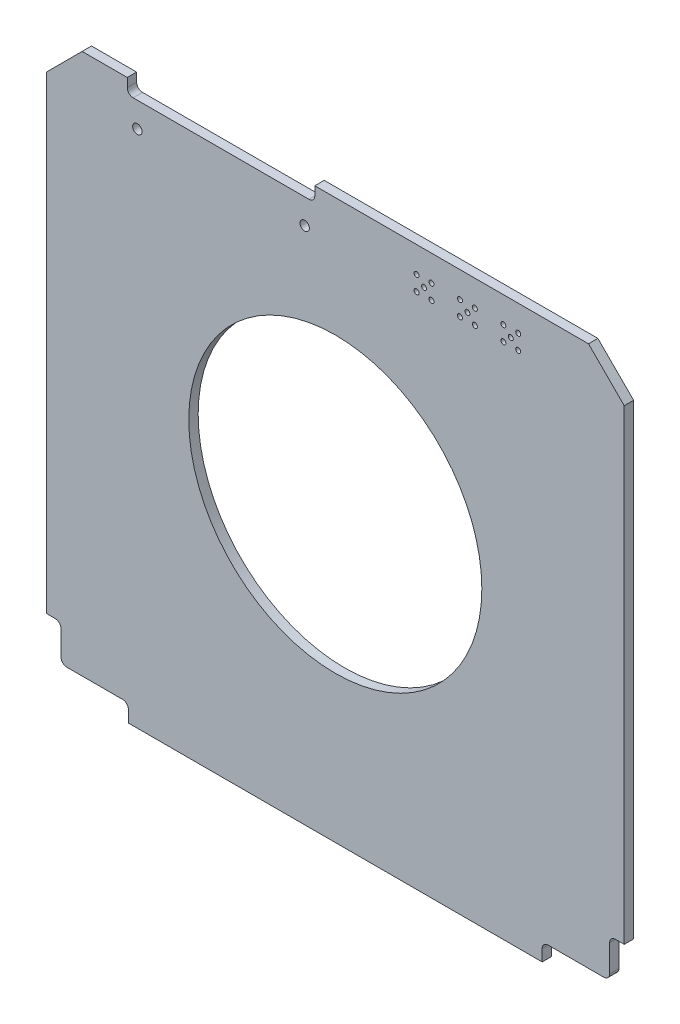
from build123d import *

# Parameters (mm, degrees)
SKETCH1_R           = 0.425
SKETCH1_R_2         = 25
SKETCH1_R_3         = 0.8
BOSS_EXTRUDE1_DEPTH = 1.6


with BuildPart() as part:
    # Sketch1 → Boss-Extrude1 (new body)
    with BuildSketch(Plane(origin=(0, 0, -0.0125), x_dir=(-1, 0, 0), z_dir=(0, 0, -1))):
        with BuildLine():
            Line((47.8, -40.8), (49.3, -40.8))
            Line((49.3, -40.8), (49.3, 39.2))
            Line((49.3, 39.2), (43.2, 45.3))
            Line((43.2, 45.3), (35.500000017, 45.3))
            Line((35.500000017, 45.3), (35.500000017, 43.8))
            ThreePointArc((35.500000017, 43.8), (35.207106799, 43.092893219), (34.500000017, 42.8))
            Line((34.500000017, 42.8), (4.500000014, 42.8))
            ThreePointArc((4.500000014, 42.8), (3.792893232, 43.092893219), (3.500000014, 43.8))
            Line((3.500000014, 43.8), (3.500000014, 45.3))
            Line((3.500000014, 45.3), (-43.2, 45.3))
            Line((-43.2, 45.3), (-49.3, 39.2))
            Line((-49.3, 39.2), (-49.3, -40.4))
            Line((-49.3, -40.4), (-47.8, -40.4))
            ThreePointArc((-47.8, -40.4), (-47.092893219, -40.692893219), (-46.8, -41.4))
            Line((-46.8, -41.4), (-46.8, -46))
            ThreePointArc((-46.8, -46), (-46.507106781, -46.707106781), (-45.8, -47))
            Line((-45.8, -47), (-36.3, -47))
            ThreePointArc((-36.3, -47), (-35.592893219, -47.292893219), (-35.3, -48))
            Line((-35.3, -48), (-35.3, -50))
            Line((-35.3, -50), (35.3, -50))
            Line((35.3, -50), (35.3, -48))
            ThreePointArc((35.3, -48), (35.592893219, -47.292893219), (36.3, -47))
            Line((36.3, -47), (45.8, -47))
            ThreePointArc((45.8, -47), (46.507106781, -46.707106781), (46.8, -46))
            Line((46.8, -46), (46.8, -41.8))
            ThreePointArc((46.8, -41.8), (47.092893219, -41.092893219), (47.8, -40.8))
        make_face()
        with Locations((-13.87, 38.33)):
            Circle(SKETCH1_R, mode=Mode.SUBTRACT)
        Circle(SKETCH1_R_2, mode=Mode.SUBTRACT)
        with Locations((-22.54, 39.6)):
            Circle(SKETCH1_R, mode=Mode.SUBTRACT)
        with Locations((-23.81, 40.87)):
            Circle(SKETCH1_R, mode=Mode.SUBTRACT)
        with Locations((-21.27, 40.87)):
            Circle(SKETCH1_R, mode=Mode.SUBTRACT)
        with Locations((-13.87, 40.87)):
            Circle(SKETCH1_R, mode=Mode.SUBTRACT)
        with Locations((-31.21, 40.87)):
            Circle(SKETCH1_R, mode=Mode.SUBTRACT)
        with Locations((-16.41, 40.87)):
            Circle(SKETCH1_R, mode=Mode.SUBTRACT)
        with Locations((-15.14, 39.6)):
            Circle(SKETCH1_R, mode=Mode.SUBTRACT)
        with Locations((-29.94, 39.6)):
            Circle(SKETCH1_R, mode=Mode.SUBTRACT)
        with Locations((-28.67, 40.87)):
            Circle(SKETCH1_R, mode=Mode.SUBTRACT)
        with Locations((-28.67, 38.33)):
            Circle(SKETCH1_R, mode=Mode.SUBTRACT)
        with Locations((-16.41, 38.33)):
            Circle(SKETCH1_R, mode=Mode.SUBTRACT)
        with Locations((-21.27, 38.33)):
            Circle(SKETCH1_R, mode=Mode.SUBTRACT)
        with Locations((-23.81, 38.33)):
            Circle(SKETCH1_R, mode=Mode.SUBTRACT)
        with Locations((-31.21, 38.33)):
            Circle(SKETCH1_R, mode=Mode.SUBTRACT)
        with Locations((33.775, 38.54)):
            Circle(SKETCH1_R_3, mode=Mode.SUBTRACT)
        with Locations((5.225, 38.54)):
            Circle(SKETCH1_R_3, mode=Mode.SUBTRACT)
    extrude(amount=-BOSS_EXTRUDE1_DEPTH)


solid = part.part
